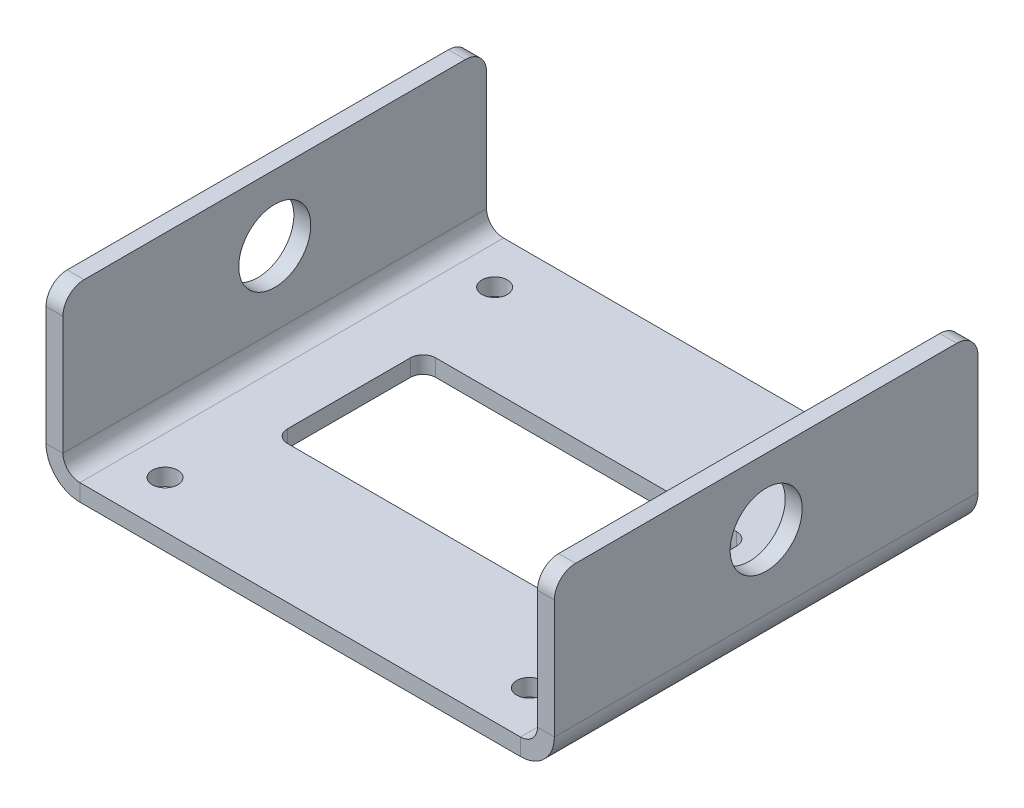
from build123d import *

# Parameters (mm, degrees)
BASE_FLANGE1_DEPTH = 100
CUT_EXTRUDE1_REACH = 163.496
SKETCH6_R          = 8.5
CUT_EXTRUDE2_REACH = 124.348
SKETCH7_R          = 3
FILLET1_R          = 5


# Sheet-metal steps are written as plain solids
with BuildPart() as part:
    # Sketch1 → Base-Flange1 (new body)
    with BuildSketch(Plane.XY):
        with BuildLine():
            Line((-60, 41), (-60, 8))
            ThreePointArc((-60, 8), (-57.656854249, 2.343145751), (-52, 0))
            Line((-52, 0), (52, 0))
            ThreePointArc((52, 0), (57.656854249, 2.343145751), (60, 8))
            Line((60, 8), (60, 41))
            Line((60, 41), (56, 41))
            Line((56, 41), (56, 8))
            ThreePointArc((56, 8), (54.828427125, 5.171572875), (52, 4))
            Line((52, 4), (-52, 4))
            ThreePointArc((-52, 4), (-54.828427125, 5.171572875), (-56, 8))
            Line((-56, 8), (-56, 41))
            Line((-56, 41), (-60, 41))
        make_face()
    extrude(amount=BASE_FLANGE1_DEPTH)

    # Cut-Extrude1: up to this face of the body (flat: up to its plane)
    cut_extrude1_end = Plane(part.part.faces().sort_by_distance((-60, 24.5, 50))[0])
    # Sketch6 → Cut-Extrude1 (cut, up to the picked face)
    with BuildSketch(Plane(origin=(60, 0, 0), x_dir=(0, 0, -1), z_dir=(1, 0, 0)), mode=Mode.PRIVATE) as cut_extrude1_sk1:
        with Locations((-50, 25.4)):
            Circle(SKETCH6_R)
    cut_extrude1_tool1 = split(extrude(cut_extrude1_sk1.sketch, amount=-CUT_EXTRUDE1_REACH, mode=Mode.PRIVATE), bisect_by=cut_extrude1_end, keep=Keep.BOTH, mode=Mode.PRIVATE)
    add(cut_extrude1_tool1.solids().sort_by(Axis((60, 25.4, 50), (-1, 0, 0)))[0], mode=Mode.SUBTRACT)

    # Sketch7 → Cut-Extrude2 (cut, up to next)
    with BuildSketch(Plane(origin=(0, 4, 0), x_dir=(1, 0, 0), z_dir=(0, 1, 0)), mode=Mode.PRIVATE) as cut_extrude2_sk1:
        with Locations(Location((-43, -11.1, 0), (0, 0, 270))):
            Circle(SKETCH7_R)
    cut_extrude2_tool1 = extrude(cut_extrude2_sk1.sketch, amount=-CUT_EXTRUDE2_REACH, mode=Mode.PRIVATE) & part.part
    # Sketch7 → Cut-Extrude2 (cut, up to next)
    with BuildSketch(Plane(origin=(0, 4, 0), x_dir=(1, 0, 0), z_dir=(0, 1, 0)), mode=Mode.PRIVATE) as cut_extrude2_sk2:
        with Locations(Location((43, -11.1, 0), (0, 0, 90))):
            Circle(SKETCH7_R)
    cut_extrude2_tool2 = extrude(cut_extrude2_sk2.sketch, amount=-CUT_EXTRUDE2_REACH, mode=Mode.PRIVATE) & part.part
    # Sketch7 → Cut-Extrude2 (cut, up to next)
    with BuildSketch(Plane(origin=(0, 4, 0), x_dir=(1, 0, 0), z_dir=(0, 1, 0)), mode=Mode.PRIVATE) as cut_extrude2_sk3:
        with Locations(Location((-43, -88.9, 0), (0, 0, 90))):
            Circle(SKETCH7_R)
    cut_extrude2_tool3 = extrude(cut_extrude2_sk3.sketch, amount=-CUT_EXTRUDE2_REACH, mode=Mode.PRIVATE) & part.part
    # Sketch7 → Cut-Extrude2 (cut, up to next)
    with BuildSketch(Plane(origin=(0, 4, 0), x_dir=(1, 0, 0), z_dir=(0, 1, 0)), mode=Mode.PRIVATE) as cut_extrude2_sk4:
        with Locations(Location((43, -88.9, 0), (0, 0, 270))):
            Circle(SKETCH7_R)
    cut_extrude2_tool4 = extrude(cut_extrude2_sk4.sketch, amount=-CUT_EXTRUDE2_REACH, mode=Mode.PRIVATE) & part.part
    # Sketch7 → Cut-Extrude2 (cut, up to next)
    with BuildSketch(Plane(origin=(0, 4, 0), x_dir=(1, 0, 0), z_dir=(0, 1, 0)), mode=Mode.PRIVATE) as cut_extrude2_sk5:
        with BuildLine():
            Line((-35.5, -67.5), (35.5, -67.5))
            ThreePointArc((35.5, -67.5), (37.621320344, -66.621320344), (38.5, -64.5))
            Line((38.5, -64.5), (38.5, -35.5))
            ThreePointArc((38.5, -35.5), (37.621320344, -33.378679656), (35.5, -32.5))
            Line((35.5, -32.5), (-35.5, -32.5))
            ThreePointArc((-35.5, -32.5), (-37.621320344, -33.378679656), (-38.5, -35.5))
            Line((-38.5, -35.5), (-38.5, -64.5))
            ThreePointArc((-38.5, -64.5), (-37.621320344, -66.621320344), (-35.5, -67.5))
        make_face()
    cut_extrude2_tool5 = extrude(cut_extrude2_sk5.sketch, amount=-CUT_EXTRUDE2_REACH, mode=Mode.PRIVATE) & part.part
    add(cut_extrude2_tool1.solids().sort_by_distance((-43, 4, 11.1))[0], mode=Mode.SUBTRACT)
    add(cut_extrude2_tool2.solids().sort_by_distance((43, 4, 11.1))[0], mode=Mode.SUBTRACT)
    add(cut_extrude2_tool3.solids().sort_by_distance((-43, 4, 88.9))[0], mode=Mode.SUBTRACT)
    add(cut_extrude2_tool4.solids().sort_by_distance((43, 4, 88.9))[0], mode=Mode.SUBTRACT)
    add(cut_extrude2_tool5.solids().sort_by_distance((0, 4, 50))[0], mode=Mode.SUBTRACT)

    # Fillet1
    fillet1_edges = [part.edges().sort_by_distance(p)[0] for p in [
        (58, 41, 0),
        (-58, 41, 0),
        (58, 41, 100),
        (-58, 41, 100),
    ]]
    fillet(fillet1_edges, radius=FILLET1_R)


solid = part.part
